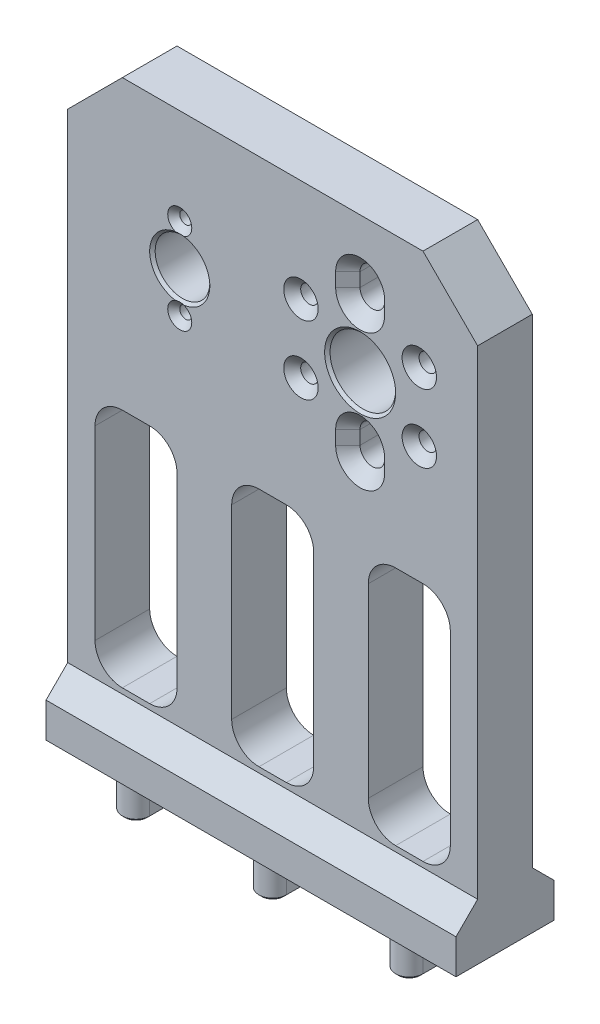
from build123d import *

# Parameters (mm, degrees)
SKETCH1_W                                       = 75
SKETCH1_H                                       = 108
BOSS_EXTRUDE1_DEPTH                             = 10
SKETCH2_R                                       = 6
SKETCH2_R_2                                     = 5
CUT_EXTRUDE2_DEPTH                              = 115.761709642
HOLE_WIZARD_M31_D                               = 3.2
HOLE_WIZARD_M31_CSINK_D                         = 6.3
HOLE_WIZARD_M31_CSINK_ANGLE                     = 90
BOSS_EXTRUDE2_DEPTH                             = 75
BOSS_EXTRUDE3_DEPTH                             = 7
CHAMFER2_SIZE                                   = 0.5
HOLE_WIZARD_M41_DEPTH                           = 10
CHAMFER4_SIZE                                   = 0.5
CUT_EXTRUDE3_DEPTH                              = 122.762603454
CSK_FOR_M2_FLAT_HEAD_MACHINE_SCREW1_D           = 2.2
CSK_FOR_M2_FLAT_HEAD_MACHINE_SCREW1_CSINK_D     = 4.4
CSK_FOR_M2_FLAT_HEAD_MACHINE_SCREW1_CSINK_ANGLE = 90
M5X0_8_TAPPED_HOLE1_D                           = 4.2
M5X0_8_TAPPED_HOLE1_DEPTH                       = 10.4
M5X0_8_TAPPED_HOLE1_TIP                         = 1.2618073
CHAMFER6_SIZE                                   = 10


with BuildPart() as part:
    # Sketch1 → Boss-Extrude1 (new body)
    with BuildSketch(Plane.XY):
        with Locations((0, -54)):
            Rectangle(SKETCH1_W, SKETCH1_H)
    extrude(amount=BOSS_EXTRUDE1_DEPTH)

    # Sketch2 → Cut-Extrude2 (cut, through all)
    with BuildSketch(Plane.XY):
        with Locations((16, -25)):
            Circle(SKETCH2_R)
        with Locations((-17, -25)):
            Circle(SKETCH2_R_2)
    extrude(amount=CUT_EXTRUDE2_DEPTH, mode=Mode.SUBTRACT)

    # Зенковка для  винта с плоской головкой M31 (through all)
    with Locations(Plane.XY.offset(10)):
        with Locations((26.825317547, -18.75), (5.174682453, -18.75), (5.174682453, -31.25), (26.825317547, -31.25)):
            CounterSinkHole(HOLE_WIZARD_M31_D / 2, HOLE_WIZARD_M31_CSINK_D / 2, counter_sink_angle=HOLE_WIZARD_M31_CSINK_ANGLE)

    # Sketch13 → Boss-Extrude2 (add, through all)
    with BuildSketch(Plane(origin=(37.5, 0, 0), x_dir=(0, 0, -1), z_dir=(1, 0, 0))):
        Polygon((-10, -97.69), (-13.96, -101.65), (-13.96, -108), (-10, -108), (0, -108), (3.96, -108), (3.96, -101.65), (0, -97.69), align=None)
    extrude(amount=-BOSS_EXTRUDE2_DEPTH)

    # Sketch14 → Boss-Extrude3 (add)
    with BuildSketch(Plane.XZ.offset(108)):
        with BuildLine():
            Line((-2.5, 0), (-2.5, 10))
            ThreePointArc((-2.5, 10), (0, 12.5), (2.5, 10))
            Line((2.5, 10), (2.5, 0))
            ThreePointArc((2.5, 0), (0, -2.5), (-2.5, 0))
        make_face()
        with BuildLine():
            Line((22.5, 0), (22.5, 10))
            ThreePointArc((22.5, 10), (25, 12.5), (27.5, 10))
            Line((27.5, 10), (27.5, 0))
            ThreePointArc((27.5, 0), (25, -2.5), (22.5, 0))
        make_face()
        with BuildLine():
            Line((-27.5, 0), (-27.5, 10))
            ThreePointArc((-27.5, 10), (-25, 12.5), (-22.5, 10))
            Line((-22.5, 10), (-22.5, 0))
            ThreePointArc((-22.5, 0), (-25, -2.5), (-27.5, 0))
        make_face()
    extrude(amount=BOSS_EXTRUDE3_DEPTH)

    # Chamfer2
    chamfer2_edges = [part.edges().sort_by_distance(p)[0] for p in [
        (-25, -115, 12.5),
        (-27.5, -115, 5),
        (-25, -115, -2.5),
        (-22.5, -115, 5),
        (0, -115, 12.5),
        (-2.5, -115, 5),
        (0, -115, -2.5),
        (2.5, -115, 5),
        (25, -115, 12.5),
        (22.5, -115, 5),
        (25, -115, -2.5),
        (27.5, -115, 5),
    ]]
    chamfer(chamfer2_edges, length=CHAMFER2_SIZE)

    # Зенковка для  винта с потайной головкой с внутренним шестигранником M41: read off the stored shape, not the designer's step
    # Зенковка для  винта с потайной головкой с внутренним шестигранником M41 outline → Зенковка для  винта с потайной головкой с внутренним шестигранником M41 (cut)
    with BuildSketch(Plane.XY):
        with BuildLine():
            Line((13.75, -36.25), (13.75, -38.75))
            ThreePointArc((13.75, -38.75), (16, -41), (18.25, -38.75))
            Line((18.25, -38.75), (18.25, -36.25))
            ThreePointArc((18.25, -36.25), (16, -34), (13.75, -36.25))
        make_face()
        with BuildLine():
            Line((18.25, -13.75), (18.25, -11.25))
            ThreePointArc((18.25, -11.25), (16, -9), (13.75, -11.25))
            Line((13.75, -11.25), (13.75, -13.75))
            ThreePointArc((13.75, -13.75), (16, -16), (18.25, -13.75))
        make_face()
    extrude(amount=HOLE_WIZARD_M41_DEPTH, mode=Mode.SUBTRACT)

    # Hole Wizard M41 2: loft between two sections, ruled curve by curve
    hole_wizard_m41_2_from = [
        Edge.make_three_point_arc((13.75, -38.75, 7.77), (14.409009742, -40.340990258, 7.77), (16, -41, 7.77)),
        Edge.make_three_point_arc((16, -41, 7.77), (17.590990258, -40.340990258, 7.77), (18.25, -38.75, 7.77)),
        Edge.make_three_point_arc((18.25, -36.25, 7.77), (17.590990258, -34.659009742, 7.77), (16, -34, 7.77)),
        Edge.make_three_point_arc((16, -34, 7.77), (14.409009742, -34.659009742, 7.77), (13.75, -36.25, 7.77)),
        Edge.make_line((18.25, -38.75, 7.77), (18.25, -36.25, 7.77)),
        Edge.make_line((13.75, -38.75, 7.77), (13.75, -36.25, 7.77)),
    ]
    hole_wizard_m41_2_to = [
        Edge.make_three_point_arc((11.52, -38.75, 10), (12.83216162, -41.91783838, 10), (16, -43.23, 10)),
        Edge.make_three_point_arc((16, -43.23, 10), (19.16783838, -41.91783838, 10), (20.48, -38.75, 10)),
        Edge.make_three_point_arc((20.48, -36.25, 10), (19.16783838, -33.08216162, 10), (16, -31.77, 10)),
        Edge.make_three_point_arc((16, -31.77, 10), (12.83216162, -33.08216162, 10), (11.52, -36.25, 10)),
        Edge.make_line((20.48, -38.75, 10), (20.48, -36.25, 10)),
        Edge.make_line((11.52, -38.75, 10), (11.52, -36.25, 10)),
    ]
    hole_wizard_m41_2 = Solid(Shell([*[Face.make_surface_from_curves(hole_wizard_m41_2_from[k], hole_wizard_m41_2_to[k]) for k in range(6)], Face(Wire(hole_wizard_m41_2_from)), Face(Wire(hole_wizard_m41_2_to))]))
    add(hole_wizard_m41_2, mode=Mode.SUBTRACT)

    # Hole Wizard M41 3: loft between two sections, ruled curve by curve
    hole_wizard_m41_3_from = [
        Edge.make_three_point_arc((13.75, -13.75, 7.77), (14.409009742, -15.340990258, 7.77), (16, -16, 7.77)),
        Edge.make_three_point_arc((16, -16, 7.77), (17.590990258, -15.340990258, 7.77), (18.25, -13.75, 7.77)),
        Edge.make_three_point_arc((18.25, -11.25, 7.77), (17.590990258, -9.659009742, 7.77), (16, -9, 7.77)),
        Edge.make_three_point_arc((16, -9, 7.77), (14.409009742, -9.659009742, 7.77), (13.75, -11.25, 7.77)),
        Edge.make_line((18.25, -13.75, 7.77), (18.25, -11.25, 7.77)),
        Edge.make_line((13.75, -13.75, 7.77), (13.75, -11.25, 7.77)),
    ]
    hole_wizard_m41_3_to = [
        Edge.make_three_point_arc((11.52, -13.75, 10), (12.83216162, -16.91783838, 10), (16, -18.23, 10)),
        Edge.make_three_point_arc((16, -18.23, 10), (19.16783838, -16.91783838, 10), (20.48, -13.75, 10)),
        Edge.make_three_point_arc((20.48, -11.25, 10), (19.16783838, -8.08216162, 10), (16, -6.77, 10)),
        Edge.make_three_point_arc((16, -6.77, 10), (12.83216162, -8.08216162, 10), (11.52, -11.25, 10)),
        Edge.make_line((20.48, -13.75, 10), (20.48, -11.25, 10)),
        Edge.make_line((11.52, -13.75, 10), (11.52, -11.25, 10)),
    ]
    hole_wizard_m41_3 = Solid(Shell([*[Face.make_surface_from_curves(hole_wizard_m41_3_from[k], hole_wizard_m41_3_to[k]) for k in range(6)], Face(Wire(hole_wizard_m41_3_from)), Face(Wire(hole_wizard_m41_3_to))]))
    add(hole_wizard_m41_3, mode=Mode.SUBTRACT)

    # Chamfer4
    chamfer4_edges = [part.edges().sort_by_distance(p)[0] for p in [
        (10, -25, 0),
        (10, -25, 10),
        (13.75, -37.5, 0),
        (16, -41, 0),
        (16, -34, 0),
        (18.25, -37.5, 0),
        (16, -9, 0),
        (18.25, -12.5, 0),
        (13.75, -12.5, 0),
        (16, -16, 0),
        (-22, -25, 0),
        (-22, -25, 10),
        (28.425317547, -31.25, 0),
        (6.774682453, -31.25, 0),
        (6.774682453, -18.75, 0),
        (28.425317547, -18.75, 0),
    ]]
    chamfer(chamfer4_edges, length=CHAMFER4_SIZE)

    # Sketch22 → Cut-Extrude3 (cut, through all)
    with BuildSketch(Plane.XY.offset(10)):
        with BuildLine():
            Line((2.5, -96.69), (-2.5, -96.69))
            ThreePointArc((-2.5, -96.69), (-6.035533906, -95.225533906), (-7.5, -91.69))
            Line((-7.5, -91.69), (-7.5, -57.69))
            ThreePointArc((-7.5, -57.69), (-6.035533906, -54.154466094), (-2.5, -52.69))
            Line((-2.5, -52.69), (2.5, -52.69))
            ThreePointArc((2.5, -52.69), (6.035533906, -54.154466094), (7.5, -57.69))
            Line((7.5, -57.69), (7.5, -91.69))
            ThreePointArc((7.5, -91.69), (6.035533906, -95.225533906), (2.5, -96.69))
        make_face()
        with BuildLine():
            Line((-22.5, -96.69), (-27.5, -96.69))
            ThreePointArc((-27.5, -96.69), (-31.035533906, -95.225533906), (-32.5, -91.69))
            Line((-32.5, -91.69), (-32.5, -57.69))
            ThreePointArc((-32.5, -57.69), (-31.035533906, -54.154466094), (-27.5, -52.69))
            Line((-27.5, -52.69), (-22.5, -52.69))
            ThreePointArc((-22.5, -52.69), (-18.964466094, -54.154466094), (-17.5, -57.69))
            Line((-17.5, -57.69), (-17.5, -91.69))
            ThreePointArc((-17.5, -91.69), (-18.964466094, -95.225533906), (-22.5, -96.69))
        make_face()
        with BuildLine():
            Line((27.5, -96.69), (22.5, -96.69))
            ThreePointArc((22.5, -96.69), (18.964466094, -95.225533906), (17.5, -91.69))
            Line((17.5, -91.69), (17.5, -57.69))
            ThreePointArc((17.5, -57.69), (18.964466094, -54.154466094), (22.5, -52.69))
            Line((22.5, -52.69), (27.5, -52.69))
            ThreePointArc((27.5, -52.69), (31.035533906, -54.154466094), (32.5, -57.69))
            Line((32.5, -57.69), (32.5, -91.69))
            ThreePointArc((32.5, -91.69), (31.035533906, -95.225533906), (27.5, -96.69))
        make_face()
    extrude(amount=-CUT_EXTRUDE3_DEPTH, mode=Mode.SUBTRACT)

    # CSK for M2 Flat Head Machine Screw1 (through all)
    with Locations(Plane.XY.offset(10)):
        with Locations((-17, -17.5), (-17, -32.5)):
            CounterSinkHole(CSK_FOR_M2_FLAT_HEAD_MACHINE_SCREW1_D / 2, CSK_FOR_M2_FLAT_HEAD_MACHINE_SCREW1_CSINK_D / 2, counter_sink_angle=CSK_FOR_M2_FLAT_HEAD_MACHINE_SCREW1_CSINK_ANGLE)

    # M5x0.8 Tapped Hole1
    with Locations(Plane(origin=(0, -108, 0), x_dir=(-1, 0, 0), z_dir=(0, -1, 0))):
        with Locations((32.5, -5), (13.75, -5), (-13.75, -5), (-32.5, -5)):
            Hole(M5X0_8_TAPPED_HOLE1_D / 2, depth=M5X0_8_TAPPED_HOLE1_DEPTH)
            with Locations((0, 0, -(M5X0_8_TAPPED_HOLE1_DEPTH + M5X0_8_TAPPED_HOLE1_TIP / 2))):  # 118° drill point
                Cone(0, M5X0_8_TAPPED_HOLE1_D / 2, M5X0_8_TAPPED_HOLE1_TIP, mode=Mode.SUBTRACT)

    # Chamfer6
    chamfer6_edges = [part.edges().sort_by_distance(p)[0] for p in [
        (-37.5, 0, 5),
        (37.5, 0, 5),
    ]]
    chamfer(chamfer6_edges, length=CHAMFER6_SIZE)


solid = part.part
